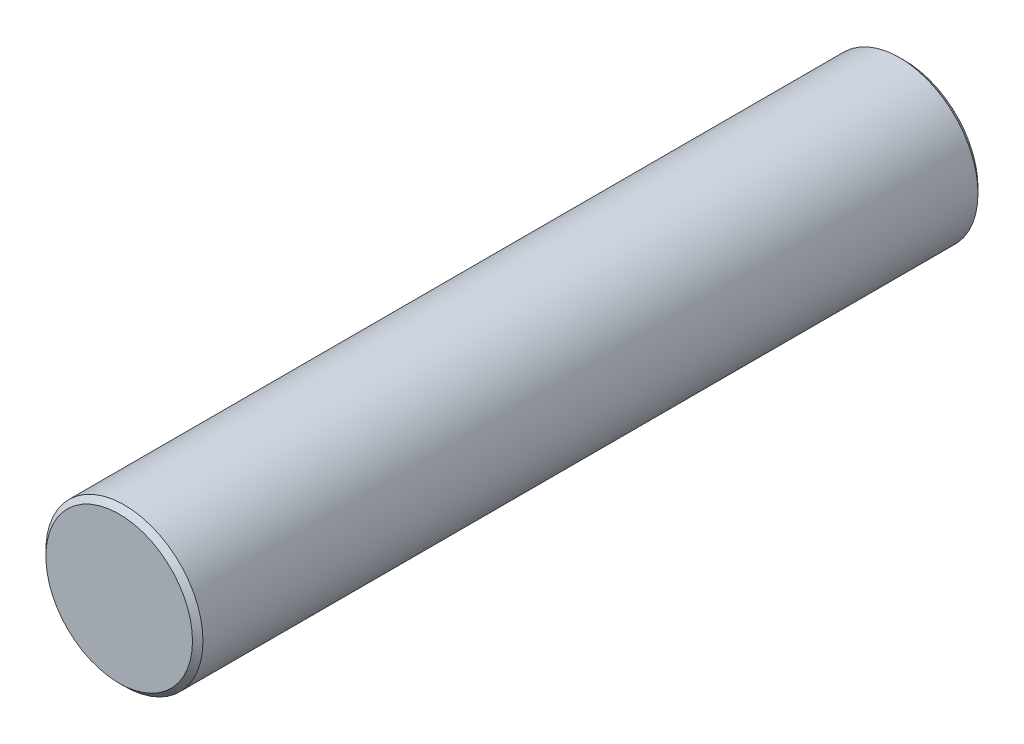
from build123d import *

# Parameters (mm, degrees)
SKETCH1_R           = 3
BOSS_EXTRUDE1_DEPTH = 30
CHAMFER1_SIZE       = 0.2


with BuildPart() as part:
    # Sketch1 → Boss-Extrude1 (new body)
    with BuildSketch(Plane.XY):
        Circle(SKETCH1_R)
    extrude(amount=BOSS_EXTRUDE1_DEPTH)

    # Chamfer1
    chamfer1_edges = [part.edges().sort_by_distance(p)[0] for p in [
        (-3, 0, 0),
        (-3, 0, 30),
    ]]
    chamfer(chamfer1_edges, length=CHAMFER1_SIZE)


solid = part.part
